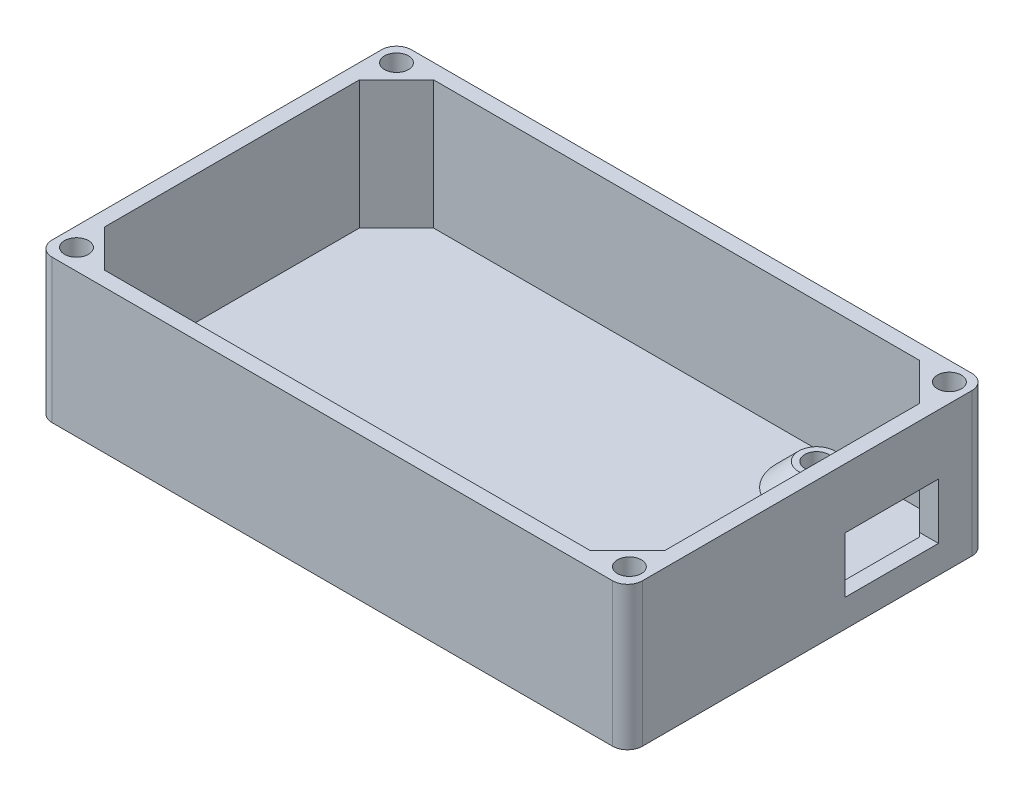
from build123d import *

# Parameters (mm, degrees)
BOSS_EXTRUDE1_DEPTH      = 18.15
BOSS_EXTRUDE1_DEPTH_BACK = 1
SKETCH1_W                = 78.86
SKETCH1_H                = 48
SHELL1_T                 = -2
BOSS_EXTRUDE2_START      = 3
SKETCH4_R                = 2
BOSS_EXTRUDE2_DEPTH      = 4.4
CHAMFER2_SIZE            = 3.4
CHAMFER3_SIZE            = 3.4
CHAMFER4_SIZE            = 3.4
BOSS_EXTRUDE4_DEPTH      = 17.15
CUT_EXTRUDE4_DEPTH       = 60.613659429
CUT_EXTRUDE4_DEPTH_BACK  = 22
SKETCH14_R               = 1.6
FILLET1_R                = 2
CUT_EXTRUDE9_REACH       = 86.549
SKETCH17_W               = 12.51
SKETCH17_H               = 7.45
SKETCH21_R               = 1.6
CUT_EXTRUDE10_DEPTH      = 4.2


with BuildPart() as part:
    # Sketch1 → Boss-Extrude1 (new, two sides: drawn at the far end of the back side and taken through both)
    with BuildSketch(Plane(origin=(0, 0, 0), x_dir=(1, 0, 0), z_dir=(0, 1, 0)).offset(-BOSS_EXTRUDE1_DEPTH_BACK)):
        with Locations((-11.43075, -0.5)):
            Rectangle(SKETCH1_W, SKETCH1_H)
    extrude(amount=BOSS_EXTRUDE1_DEPTH + BOSS_EXTRUDE1_DEPTH_BACK)

    # Shell1
    shell1_openings = [part.faces().sort_by_distance(p)[0] for p in [
        (-11.43075, 18.15, 0.5),
    ]]
    offset(amount=SHELL1_T, openings=shell1_openings, kind=Kind.INTERSECTION)

    # Sketch4 → Boss-Extrude2 (add)
    with BuildSketch(Plane(origin=(0, 1, 0), x_dir=(1, 0, 0), z_dir=(0, 1, 0)).offset(BOSS_EXTRUDE2_START)):
        with Locations(Location((-35.69075, -17.71, 0), (0, 0, 270))):
            Circle(SKETCH4_R)
        with Locations(Location((-4.71075, -11.75, 0), (0, 0, 270))):
            Circle(SKETCH4_R)
        with Locations(Location((11.67925, 17.1, 0), (0, 0, 270))):
            Circle(SKETCH4_R)
    extrude(amount=-BOSS_EXTRUDE2_DEPTH)

    # Chamfer2
    # the kernel refuses this chamfer: 3.4 mm, written as the material it adds along each edge
    with BuildSketch(Plane(origin=(-4.71075, 1, 11.75), x_dir=(0, 0, 1), z_dir=(-1, 0, 0))) as chamfer2_piece_1_section:
        Polygon((2 + CHAMFER2_SIZE, 0), (2, CHAMFER2_SIZE), (2, 0), align=None)
    chamfer2_piece_1 = revolve(axis=Axis((-4.71075, 1, 11.75), (0, 1, 0)), mode=Mode.PRIVATE)
    chamfer2_piece_1 = split(chamfer2_piece_1, bisect_by=Plane(origin=(-4.71075, 4, 7.837068743), z_dir=(0, -1, 0)), keep=Keep.TOP, mode=Mode.PRIVATE)
    add(chamfer2_piece_1)

    # Chamfer3
    # the kernel refuses this chamfer: 3.4 mm, written as the material it adds along each edge
    with BuildSketch(Plane(origin=(11.67925, 1, -17.1), x_dir=(0, 0, 1), z_dir=(-1, 0, 0))) as chamfer3_piece_1_section:
        Polygon((2 + CHAMFER3_SIZE, 0), (2, CHAMFER3_SIZE), (2, 0), align=None)
    chamfer3_piece_1 = revolve(axis=Axis((11.67925, 1, -17.1), (0, 1, 0)), mode=Mode.PRIVATE)
    chamfer3_piece_1 = split(chamfer3_piece_1, bisect_by=Plane(origin=(11.67925, 4, -21.012931257), z_dir=(0, -1, 0)), keep=Keep.TOP, mode=Mode.PRIVATE)
    add(chamfer3_piece_1)

    # Chamfer4
    # the kernel refuses this chamfer: 3.4 mm, written as the material it adds along each edge
    with BuildSketch(Plane(origin=(-35.69075, 1, 17.71), x_dir=(0, 0, 1), z_dir=(-1, 0, 0))) as chamfer4_piece_1_section:
        Polygon((2 + CHAMFER4_SIZE, 0), (2, CHAMFER4_SIZE), (2, 0), align=None)
    chamfer4_piece_1 = revolve(axis=Axis((-35.69075, 1, 17.71), (0, 1, 0)), mode=Mode.PRIVATE)
    chamfer4_piece_1 = split(chamfer4_piece_1, bisect_by=Plane(origin=(-35.69075, 4, 13.797068743), z_dir=(0, -1, 0)), keep=Keep.TOP, mode=Mode.PRIVATE)
    add(chamfer4_piece_1)

    # Sketch9 → Boss-Extrude4 (add)
    with BuildSketch(Plane(origin=(0, 1, 0), x_dir=(1, 0, 0), z_dir=(0, 1, 0))):
        Polygon((-48.86075, 16.53575), (-43.8965, 21.5), (-48.86075, 21.5), align=None)
        Polygon((21.035, 21.5), (25.99925, 16.53575), (25.99925, 21.5), align=None)
        Polygon((25.99925, -17.53575), (21.035, -22.5), (25.99925, -22.5), align=None)
        Polygon((-43.8965, -22.5), (-48.86075, -17.53575), (-48.86075, -22.5), align=None)
    extrude(amount=BOSS_EXTRUDE4_DEPTH)

    # Sketch14 → Cut-Extrude4 (cut, two sides: drawn at the far end of the back side and taken through both)
    with BuildSketch(Plane(origin=(0, 18.15, 0), x_dir=(1, 0, 0), z_dir=(0, 1, 0)).offset(-CUT_EXTRUDE4_DEPTH_BACK)):
        with Locations(Location((-48.36075, 21, 0), (0, 0, 90))):
            Circle(SKETCH14_R)
        with Locations(Location((25.49925, 21, 0), (0, 0, 90))):
            Circle(SKETCH14_R)
        with Locations(Location((25.49925, -21.75, 0), (0, 0, 90))):
            Circle(SKETCH14_R)
        with Locations(Location((-48.36075, -21.75, 0), (0, 0, 90))):
            Circle(SKETCH14_R)
    extrude(amount=CUT_EXTRUDE4_DEPTH + CUT_EXTRUDE4_DEPTH_BACK, mode=Mode.SUBTRACT)

    # Fillet1
    fillet1_edges = [part.edges().sort_by_distance(p)[0] for p in [
        (-50.86075, 8.575, -23.5),
        (27.99925, 8.575, -23.5),
        (27.99925, 8.575, 24.5),
        (-50.86075, 8.575, 24.5),
    ]]
    fillet(fillet1_edges, radius=FILLET1_R)

    # Sketch17 → Cut-Extrude9 (cut, up to next)
    with BuildSketch(Plane(origin=(27.99925, 0, 0), x_dir=(0, 0, -1), z_dir=(1, 0, 0)), mode=Mode.PRIVATE) as cut_extrude9_sk1:
        with Locations((10.785, 6.425)):
            Rectangle(SKETCH17_W, SKETCH17_H)
    cut_extrude9_tool1 = extrude(cut_extrude9_sk1.sketch, amount=-CUT_EXTRUDE9_REACH, mode=Mode.PRIVATE) & part.part
    add(cut_extrude9_tool1.solids().sort_by_distance((27.99925, 6.425, -10.785))[0], mode=Mode.SUBTRACT)

    # Sketch21 → Cut-Extrude10 (cut)
    with BuildSketch(Plane(origin=(0, 4, 0), x_dir=(1, 0, 0), z_dir=(0, 1, 0))):
        with Locations(Location((11.67925, 17.1, 0), (0, 0, 270))):
            Circle(SKETCH21_R)
        with Locations(Location((-4.71075, -11.75, 0), (0, 0, 270))):
            Circle(SKETCH21_R)
        with Locations(Location((-35.69075, -17.71, 0), (0, 0, 270))):
            Circle(SKETCH21_R)
    extrude(amount=-CUT_EXTRUDE10_DEPTH, mode=Mode.SUBTRACT)


solid = part.part
